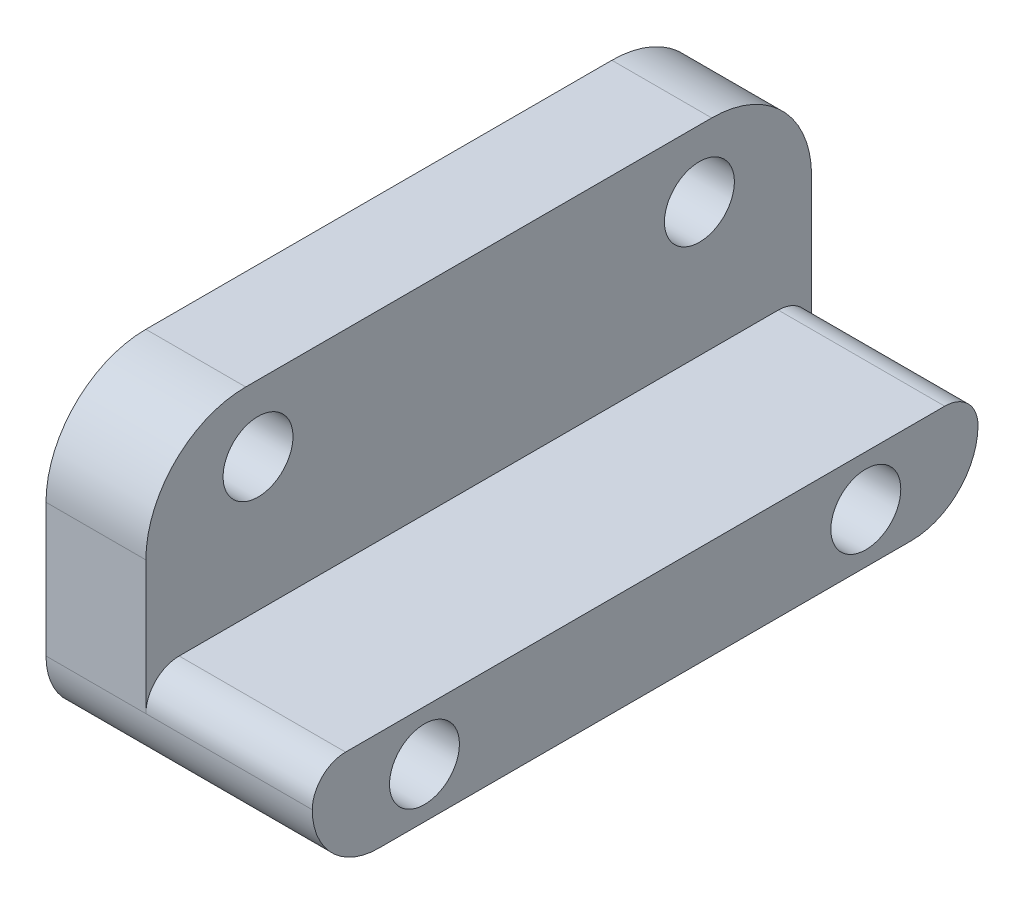
from build123d import *

# Parameters (mm, degrees)
SKETCH_1_W          = 20
SKETCH_1_H          = 9
SKETCH_1_R          = 1.05
EXTRUDE_1_DEPTH     = 3
SKETCH_2_W          = 20
SKETCH_2_H          = 3
EXTRUDE_2_DEPTH     = 5
SKETCH_3_R          = 1.05
CUT_EXTRUDE_1_DEPTH = 10
FILLET_1_R          = 3
FILLET_2_R          = 3
FILLET_3_R          = 2
FILLET_4_R          = 2
FILLET_7_R          = 1
FILLET_8_R          = 1


with BuildPart() as part:
    # 草图1 → 凸台-拉伸1 (new body)
    with BuildSketch(Plane(origin=(0, 0, 0), x_dir=(0, 0, -1), z_dir=(1, 0, 0))):
        with Locations((10, -4.5)):
            Rectangle(SKETCH_1_W, SKETCH_1_H)
        with Locations((3.37, -2)):
            Circle(SKETCH_1_R, mode=Mode.SUBTRACT)
        with Locations(Location((16.63, -2, 0), (0, 0, 180))):
            Circle(SKETCH_1_R, mode=Mode.SUBTRACT)
    extrude(amount=EXTRUDE_1_DEPTH)

    # 草图2 → 凸台-拉伸2 (add)
    with BuildSketch(Plane(origin=(3, 0, 0), x_dir=(0, 0, -1), z_dir=(1, 0, 0))):
        with Locations((10, -7.5)):
            Rectangle(SKETCH_2_W, SKETCH_2_H)
    extrude(amount=EXTRUDE_2_DEPTH)

    # 草图3 → 切除-拉伸1 (cut)
    with BuildSketch(Plane(origin=(8, 0, 0), x_dir=(0, 0, -1), z_dir=(1, 0, 0))):
        with Locations((3.37, -7.5)):
            Circle(SKETCH_3_R)
        with Locations((16.63, -7.5)):
            Circle(SKETCH_3_R)
    extrude(amount=-CUT_EXTRUDE_1_DEPTH, mode=Mode.SUBTRACT)

    # 圆角1
    fillet_1_edges = [part.edges().sort_by_distance(p)[0] for p in [
        (1.5, 0, 0),
    ]]
    fillet(fillet_1_edges, radius=FILLET_1_R)

    # 圆角2
    fillet_2_edges = [part.edges().sort_by_distance(p)[0] for p in [
        (1.5, 0, -20),
    ]]
    fillet(fillet_2_edges, radius=FILLET_2_R)

    # 圆角3
    fillet_3_edges = [part.edges().sort_by_distance(p)[0] for p in [
        (4, -9, -20),
    ]]
    fillet(fillet_3_edges, radius=FILLET_3_R)

    # 圆角4
    fillet_4_edges = [part.edges().sort_by_distance(p)[0] for p in [
        (4, -9, 0),
    ]]
    fillet(fillet_4_edges, radius=FILLET_4_R)

    # 圆角7
    fillet_7_edges = [part.edges().sort_by_distance(p)[0] for p in [
        (5.5, -6, 0),
    ]]
    fillet(fillet_7_edges, radius=FILLET_7_R - 0.0001)  # a hair under: the kernel refuses the full size

    # 圆角8
    fillet_8_edges = [part.edges().sort_by_distance(p)[0] for p in [
        (5.5, -6, -20),
    ]]
    fillet(fillet_8_edges, radius=FILLET_8_R - 0.0001)  # a hair under: the kernel refuses the full size


solid = part.part
